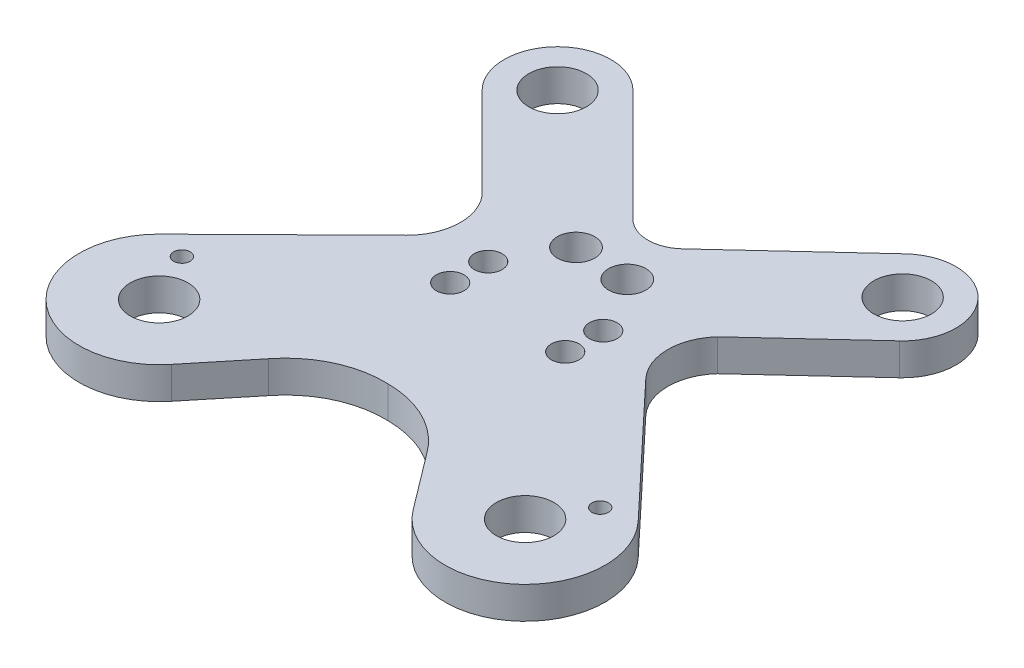
from build123d import *
from build123d.topology import SkipClean

# Parameters (mm, degrees)
SZKIC13_R                          = 5.4
DODANIE_WYCI_GNI_CIE3_DEPTH        = 6
OBIEKT_PRZENIE_KOPIUJ1_START       = -54.137810474
OBIEKT_PRZENIE_KOPIUJ1_DEPTH       = 123.583165808
OBIEKT_PRZENIE_KOPIUJ1_START_2     = 6
OBIEKT_PRZENIE_KOPIUJ1_2_DEPTH     = 63.445355334
OBIEKT_PRZENIE_KOPIUJ1_3_DEPTH     = 54.137810474
OBIEKT_PRZENIE_KOPIUJ1_4_OUTLINE_R = 5.4
OBIEKT_PRZENIE_KOPIUJ1_4_DEPTH     = 6
SZKIC15_R                          = 2.6
WYTNIJ_WYCI_GNI_CIE3_DEPTH         = 136.234453644
SZKIC16_R                          = 1.549999999
WYTNIJ_WYCI_GNI_CIE4_DEPTH         = 134.002110995
WYTNIJ_WYCI_GNI_CIE6_START         = -6
WYTNIJ_WYCI_GNI_CIE6_DEPTH         = 6
SZKIC21_R                          = 3.5
WYTNIJ_WYCI_GNI_CIE7_DEPTH         = 10


# Read off the part's stored shape, not the designer's step: Obiekt-Przenieś/Kopiuj1
with BuildPart() as part:
    # Szkic13 → Dodanie-wyciągnięcie3 (new body)
    with BuildSketch(Plane(origin=(39.644620081, 0, -39.644620081), x_dir=(0.5000000000000003, 0.7071067811865474, 0.4999999999999999), z_dir=(-0.7071067811865474, 0, 0.7071067811865478))):
        with BuildLine():
            Line((-26.485954128, 69.418447832), (-4.834933244, 89.451777745))
            ThreePointArc((-4.834933244, 89.451777745), (9.296564873, 88.903360978), (8.748148106, 74.77186286))
            Line((8.748148106, 74.77186286), (-9.022064337, 58.329380521))
            ThreePointArc((-9.022064337, 58.329380521), (-11.594140152, 51.528763252), (-8.880109301, 44.783542294))
            Line((-8.880109301, 44.783542294), (13.650061572, 20.82128103))
            ThreePointArc((13.650061572, 20.82128103), (12.1147202, -0.864967436), (-9.466757772, 1.760000028))
            Line((-9.466757772, 1.760000028), (-17.276570768, 12.111077891))
            ThreePointArc((-17.276570768, 12.111077891), (-23.840592648, 17.766605638), (-32.257835604, 19.821209823))
            ThreePointArc((-32.257835604, 19.821209823), (-40.748422568, 18.094562685), (-47.526822354, 12.697834632))
            Line((-47.526822354, 12.697834632), (-55.73216456, 2.657398822))
            ThreePointArc((-55.73216456, 2.657398822), (-77.39920267, 0.871312261), (-78.092419853, 22.600787532))
            Line((-78.092419853, 22.600787532), (-54.649965194, 45.671329009))
            ThreePointArc((-54.649965194, 45.671329009), (-51.676403404, 52.306229122), (-53.982823937, 59.201473392))
            Line((-53.982823937, 59.201473392), (-71.102048157, 76.320697612))
            ThreePointArc((-71.102048157, 76.320697612), (-71.102048157, 90.462833236), (-56.959912533, 90.462833236))
            Line((-56.959912533, 90.462833236), (-36.102048157, 69.604968859))
            ThreePointArc((-36.102048157, 69.604968859), (-31.32360944, 67.985252158), (-26.485954128, 69.418447832))
        make_face()
        with Locations(Location((-67.414852174, 12.0656298, 0), (0, 0, 315))):
            Circle(SZKIC13_R, mode=Mode.SUBTRACT)
        with Locations(Location((-64.030980345, 83.391765424, 0), (0, 0, 315))):
            Circle(SZKIC13_R, mode=Mode.SUBTRACT)
        with Locations(Location((2.571983346, 10.708112247, 0), (0, 0, 135))):
            Circle(SZKIC13_R, mode=Mode.SUBTRACT)
        with Locations(Location((1.956607431, 82.111820303, 0), (0, 0, 135))):
            Circle(SZKIC13_R, mode=Mode.SUBTRACT)
    extrude(amount=DODANIE_WYCI_GNI_CIE3_DEPTH)

    # Obiekt-Przenieś/Kopiuj1 outline → Obiekt-Przenieś/Kopiuj1 (cut)
    with BuildSketch(Plane(origin=(0, 0, 0), x_dir=(1, 0, 0), z_dir=(0, 1, 0)).offset(OBIEKT_PRZENIE_KOPIUJ1_START)):
        with BuildLine():
            Line((52.289240162, 27), (10.510980812, 68.77825935))
            ThreePointArc((10.510980812, 68.77825935), (8.120217457, 66.834960669), (5.382849455, 65.421109333))
            Line((5.382849455, 65.421109333), (41.940516661, 28.863442126))
            Line((41.940516661, 28.863442126), (43.803958787, 27))
            Line((43.803958787, 27), (52.289240162, 27))
        make_face()
        with BuildLine():
            ThreePointArc((-3.913997524, 83.203237686), (-3.913997524, 75.56648445), (3.722755712, 75.56648445))
            Line((3.722755712, 75.56648445), (-3.913997524, 83.203237686))
        make_face()
        with BuildLine():
            Line((-45.380461302, 116.18442009), (-14.05937264, 84.863331428))
            ThreePointArc((-14.05937264, 84.863331428), (-12.673028326, 87.558527478), (-10.773188585, 89.9200188))
            Line((-10.773188585, 89.9200188), (-10.701414264, 89.990654426))
            Line((-10.701414264, 89.990654426), (-47, 126.289240162))
            Line((-47, 126.289240162), (-47, 117.803958788))
            Line((-47, 117.803958788), (-45.380461302, 116.18442009))
        make_face()
    extrude(amount=OBIEKT_PRZENIE_KOPIUJ1_DEPTH, mode=Mode.SUBTRACT)

    # Obiekt-Przenie_Kopiuj1 2 outline → Obiekt-Przenie_Kopiuj1 2 (cut)
    with BuildSketch(Plane(origin=(0, 0, 0), x_dir=(1, 0, 0), z_dir=(0, 1, 0)).offset(OBIEKT_PRZENIE_KOPIUJ1_START_2)):
        with BuildLine():
            ThreePointArc((5.382849455, 65.421109333), (8.120217457, 66.834960669), (10.510980812, 68.77825935))
            Line((10.510980812, 68.77825935), (3.722755712, 75.56648445))
            ThreePointArc((3.722755712, 75.56648445), (-3.913997524, 75.56648445), (-3.913997524, 83.203237686))
            Line((-3.913997524, 83.203237686), (-10.701414264, 89.990654426))
            Line((-10.701414264, 89.990654426), (-10.773188585, 89.9200188))
            ThreePointArc((-10.773188585, 89.9200188), (-12.673028326, 87.558527478), (-14.05937264, 84.863331428))
            Line((-14.05937264, 84.863331428), (5.382849455, 65.421109333))
        make_face()
    extrude(amount=OBIEKT_PRZENIE_KOPIUJ1_2_DEPTH, mode=Mode.SUBTRACT)

    # Obiekt-Przenie_Kopiuj1 3 outline → Obiekt-Przenie_Kopiuj1 3 (cut)
    with BuildSketch(Plane(origin=(0, 0, 0), x_dir=(1, 0, 0), z_dir=(0, 1, 0)).offset(OBIEKT_PRZENIE_KOPIUJ1_START)):
        with BuildLine():
            ThreePointArc((5.382849455, 65.421109333), (8.120217457, 66.834960669), (10.510980812, 68.77825935))
            Line((10.510980812, 68.77825935), (3.722755712, 75.56648445))
            ThreePointArc((3.722755712, 75.56648445), (-3.913997524, 75.56648445), (-3.913997524, 83.203237686))
            Line((-3.913997524, 83.203237686), (-10.701414264, 89.990654426))
            Line((-10.701414264, 89.990654426), (-10.773188585, 89.9200188))
            ThreePointArc((-10.773188585, 89.9200188), (-12.673028326, 87.558527478), (-14.05937264, 84.863331428))
            Line((-14.05937264, 84.863331428), (5.382849455, 65.421109333))
        make_face()
    extrude(amount=OBIEKT_PRZENIE_KOPIUJ1_3_DEPTH, mode=Mode.SUBTRACT)

    # Obiekt-Przenie_Kopiuj1 4 outline → Obiekt-Przenie_Kopiuj1 4 (add)
    # profile 1 of 2: a face of its own
    with SkipClean():  # the faces are left unmerged after this step: merging them gives an invalid solid
        with BuildSketch(Plane(origin=(0, 0, 0), x_dir=(1, 0, 0), z_dir=(0, 1, 0))):
            with BuildLine():
                ThreePointArc((10.510980812, 68.77825935), (11.065119564, 69.362991373), (11.587066708, 69.97663009))
                Line((11.587066708, 69.97663009), (19.792408914, 80.0170659))
                ThreePointArc((19.792408914, 80.0170659), (26.5708087, 85.413793952), (35.061395664, 87.14044109))
                ThreePointArc((35.061395664, 87.14044109), (43.47863862, 85.085836906), (50.0426605, 79.430309159))
                Line((50.0426605, 79.430309159), (57.852473496, 69.079231296))
                ThreePointArc((57.852473496, 69.079231296), (79.433951468, 66.454263832), (80.969292839, 88.140512298))
                Line((80.969292839, 88.140512298), (58.439121967, 112.102773562))
                ThreePointArc((58.439121967, 112.102773562), (55.725091116, 118.84799452), (58.297166931, 125.648611789))
                Line((58.297166931, 125.648611789), (76.067379374, 142.091094128))
                ThreePointArc((76.067379374, 142.091094128), (76.615796141, 156.222592245), (62.484298024, 156.771009013))
                Line((62.484298024, 156.771009013), (40.83327714, 136.7376791))
                ThreePointArc((40.83327714, 136.7376791), (35.995621828, 135.304483426), (31.217183111, 136.924200127))
                Line((31.217183111, 136.924200127), (10.359318735, 157.782064504))
                ThreePointArc((10.359318735, 157.782064504), (-3.782816889, 157.782064504), (-3.782816889, 143.63992888))
                Line((-3.782816889, 143.63992888), (13.33640733, 126.52070466))
                ThreePointArc((13.33640733, 126.52070466), (15.642827864, 119.62546039), (12.669266074, 112.990560277))
                Line((12.669266074, 112.990560277), (-10.701414264, 89.990654426))
                Line((-10.701414264, 89.990654426), (-3.913997524, 83.203237686))
                ThreePointArc((-3.913997524, 83.203237686), (3.722755712, 83.203237686), (3.722755712, 75.56648445))
                Line((3.722755712, 75.56648445), (10.510980812, 68.77825935))
            make_face()
            with Locations((69.891214614, 78.027343515)):
                Circle(OBIEKT_PRZENIE_KOPIUJ1_4_OUTLINE_R, mode=Mode.SUBTRACT)
            with Locations((3.288250923, 150.710996692)):
                Circle(OBIEKT_PRZENIE_KOPIUJ1_4_OUTLINE_R, mode=Mode.SUBTRACT)
            with Locations((69.275838699, 149.43105157)):
                Circle(OBIEKT_PRZENIE_KOPIUJ1_4_OUTLINE_R, mode=Mode.SUBTRACT)
        # profile 2 of 2: a face of its own
        with BuildSketch(Plane(origin=(0, 0, 0), x_dir=(1, 0, 0), z_dir=(0, 1, 0))):
            with BuildLine():
                ThreePointArc((-14.05937264, 84.863331428), (-10.702222624, 68.778259349), (5.382849455, 65.421109333))
                Line((5.382849455, 65.421109333), (-14.05937264, 84.863331428))
            make_face()
        extrude(amount=OBIEKT_PRZENIE_KOPIUJ1_4_DEPTH)

    # Szkic15 → Wytnij-wyciągnięcie3 (cut, through all)
    with SkipClean():  # the faces are left unmerged after this step: merging them gives an invalid solid
        with BuildSketch(Plane(origin=(35.401979394, 0, -35.401979394), x_dir=(0.7071067811865477, 0, 0.7071067811865475), z_dir=(0, 1, 0))):
            with Locations(Location((-60.022716756, 44.591718177, 0), (0, 0, 315))):
                Circle(SZKIC15_R)
            with Locations(Location((-64.875542369, 49.636525763, 0), (0, 0, 315))):
                Circle(SZKIC15_R)
            with Locations(Location((-44.167607201, 59.843455816, 0), (0, 0, 315))):
                Circle(SZKIC15_R)
            with Locations(Location((-49.020432814, 64.888263402, 0), (0, 0, 315))):
                Circle(SZKIC15_R)
        extrude(amount=WYTNIJ_WYCI_GNI_CIE3_DEPTH, mode=Mode.SUBTRACT)

    # Szkic16 → Wytnij-wyciągnięcie4 (cut, through all)
    with SkipClean():  # the faces are left unmerged after this step: merging them gives an invalid solid
        with BuildSketch(Plane(origin=(39.644620081, 0, -39.644620081), x_dir=(0.7071067811865477, 0, 0.7071067811865475), z_dir=(0, -1, 0))):
            with Locations(Location((-8.389025144, -58.480741313, 0), (0, 0, 225))):
                Circle(SZKIC16_R)
            with Locations(Location((-66.04396898, -3.019877172, 0), (0, 0, 225))):
                Circle(SZKIC16_R)
        extrude(amount=-WYTNIJ_WYCI_GNI_CIE4_DEPTH, mode=Mode.SUBTRACT)

    # Szkic19 → Wytnij-wyciągnięcie6 (cut)
    with SkipClean():  # the faces are left unmerged after this step: merging them gives an invalid solid
        with BuildSketch(Plane(origin=(0, 6, 0), x_dir=(1, 0, 0), z_dir=(0, 1, 0)).offset(WYTNIJ_WYCI_GNI_CIE6_START)):
            with BuildLine():
                ThreePointArc((31.217183111, 136.924200127), (35.986600356, 134.839381332), (40.83327714, 136.7376791))
                ThreePointArc((40.83327714, 136.7376791), (35.995621828, 135.304483426), (31.217183111, 136.924200127))
            make_face()
        extrude(amount=WYTNIJ_WYCI_GNI_CIE6_DEPTH, mode=Mode.SUBTRACT)

    # Szkic21 → Wytnij-wyciągnięcie7 (cut)
    with SkipClean():  # the faces are left unmerged after this step: merging them gives an invalid solid
        with BuildSketch(Plane.XZ):
            with Locations(Location((40.536067614, -126.534237996, 0), (0, 0, 270))):
                Circle(SZKIC21_R)
            with Locations(Location((30.543589467, -126.922027211, 0), (0, 0, 270))):
                Circle(SZKIC21_R)
        extrude(amount=-WYTNIJ_WYCI_GNI_CIE7_DEPTH, mode=Mode.SUBTRACT)


solid = part.part
